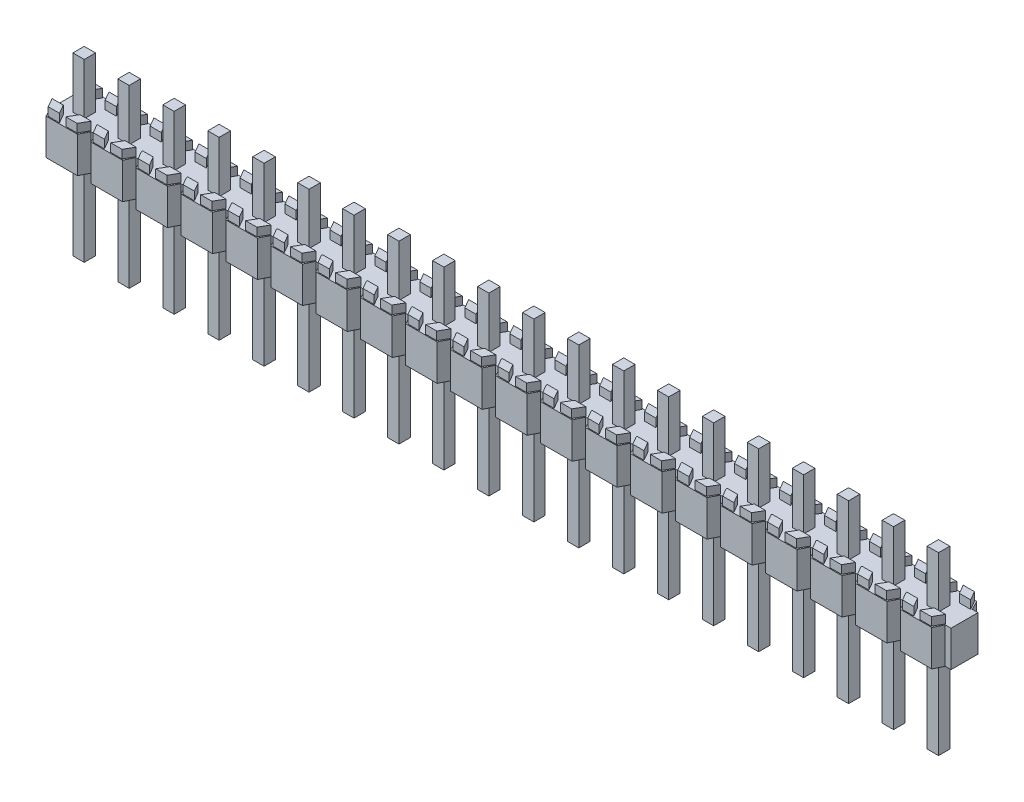
from build123d import *

# Parameters (mm, degrees)
BOSS_EXTRUDE1_START = -1.02
SKETCH1_W           = 0.64
SKETCH1_H           = 0.64
BOSS_EXTRUDE1_DEPTH = 2.5
CUT_EXTRUDE2_DEPTH  = 0.47
SKETCH3_W           = 0.64
SKETCH3_H           = 0.64
BOSS_EXTRUDE2_DEPTH = 2.9
SKETCH4_W           = 0.64
SKETCH4_H           = 0.64
BOSS_EXTRUDE3_DEPTH = 5
LPATTERN1_COUNT     = 20
LPATTERN1_PITCH     = 2.54


with BuildPart() as part:
    # Sketch1 → Boss-Extrude1 (new body)
    with BuildSketch(Plane(origin=(0, 0, 0), x_dir=(1, 0, 0), z_dir=(0, 1, 0)).offset(BOSS_EXTRUDE1_START)):
        Polygon((-1.143, 0.762), (-0.889, 1.27), (0.889, 1.27), (1.143, 0.762), (1.47, 0.762), (1.47, -0.762), (1.143, -0.762), (0.889, -1.27), (-0.889, -1.27), (-1.143, -0.762), align=None)
        Rectangle(SKETCH1_W, SKETCH1_H, mode=Mode.SUBTRACT)
    boss_extrude1 = extrude(amount=BOSS_EXTRUDE1_DEPTH)

    # Sketch2 → Cut-Extrude2 (cut)
    with BuildSketch(Plane(origin=(0, 1.48, 0), x_dir=(1, 0, 0), z_dir=(0, 1, 0))):
        Polygon((-1.143, 0.762), (-1.143, -0.762), (-0.889, -1.27), (0.889, -1.27), (1.143, -0.762), (1.47, -0.762), (1.47, 0.762), (1.143, 0.762), (0.889, 1.27), (-0.889, 1.27), align=None)
        Polygon((-1.106093937, -0.7112), (-0.471093937, -0.7112), (-0.1778, -1.2192), (-0.8128, -1.2192), align=None, mode=Mode.SUBTRACT)
        Polygon((-0.8128, 1.2192), (-1.106093937, 0.7112), (-0.471093937, 0.7112), (-0.1778, 1.2192), align=None, mode=Mode.SUBTRACT)
        Polygon((1.106093937, 0.7112), (0.471093937, 0.7112), (0.1778, 1.2192), (0.8128, 1.2192), align=None, mode=Mode.SUBTRACT)
        Polygon((0.8128, -1.2192), (1.106093937, -0.7112), (0.471093937, -0.7112), (0.1778, -1.2192), align=None, mode=Mode.SUBTRACT)
    cut_extrude2 = extrude(amount=-CUT_EXTRUDE2_DEPTH, mode=Mode.SUBTRACT)


with BuildPart() as body_2:
    # Sketch3 → Boss-Extrude2 (new body)
    with BuildSketch(Plane(origin=(0, 1.01, 0), x_dir=(1, 0, 0), z_dir=(0, 1, 0))):
        Rectangle(SKETCH3_W, SKETCH3_H)
    boss_extrude2 = extrude(amount=BOSS_EXTRUDE2_DEPTH)


with BuildPart() as body_3:
    # Sketch4 → Boss-Extrude3 (new body)
    with BuildSketch(Plane.XZ.offset(1.02)):
        Rectangle(SKETCH4_W, SKETCH4_H)
    boss_extrude3 = extrude(amount=BOSS_EXTRUDE3_DEPTH)


with BuildPart() as part_1:
    add(part.part)

    # LPattern1: Boss-Extrude1, Cut-Extrude2, Boss-Extrude2, Boss-Extrude3 ×20
    with Locations(*[(i * LPATTERN1_PITCH, 0, 0) for i in range(1, LPATTERN1_COUNT)]):
        add(boss_extrude1)
        add(cut_extrude2, mode=Mode.SUBTRACT)
        add(boss_extrude2)
        add(boss_extrude3)


solid = Compound([body_2.part, body_3.part, part_1.part])
